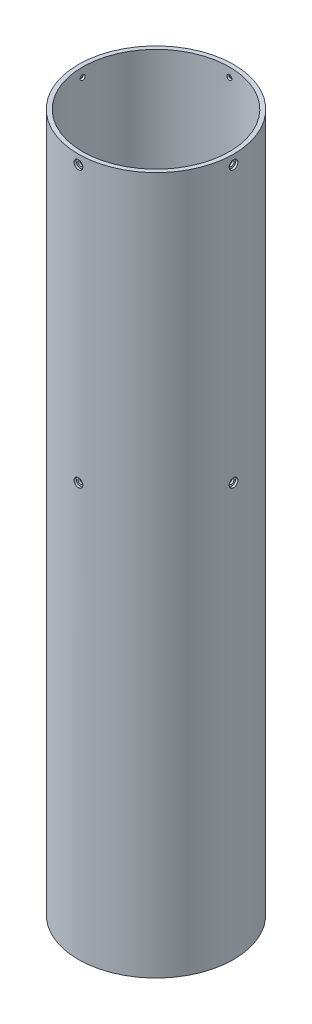
from build123d import *

# Parameters (mm, degrees)
SKETCH1_R                         = 53.721
SKETCH1_R_2                       = 50.8
BODY_EXTRUSION_DEPTH              = 482.6
UPPER_BULKHEAD_HOLES_REACH        = 499.325
SKETCH2_R                         = 1.7526
UPPER_BULKHEAD_HOLE_PATTERN_COUNT = 4
LOWER_BULKHEAD_HOLES_REACH        = 499.325
SKETCH3_R                         = 1.7526
LOWER_BULKHEAD_HOLE_PATTERN_COUNT = 4
SKETCH4_R                         = 3.0226
COUNTERSINK_DEPTH                 = 1.524
COUNTERSINK_PATTERN_COUNT         = 4


with BuildPart() as part:
    # Sketch1 → Body Extrusion (new body)
    with BuildSketch(Plane(origin=(0, 0, 0), x_dir=(1, 0, 0), z_dir=(0, 1, 0))):
        Circle(SKETCH1_R)
        Circle(SKETCH1_R_2, mode=Mode.SUBTRACT)
    extrude(amount=BODY_EXTRUSION_DEPTH)

    # Sketch2 → Upper Bulkhead Holes (cut, up to next)
    with BuildSketch(Plane.XY.offset(53.721), mode=Mode.PRIVATE) as upper_bulkhead_holes_sk1:
        with Locations((0, 476.25)):
            Circle(SKETCH2_R)
    upper_bulkhead_holes_tool1 = extrude(upper_bulkhead_holes_sk1.sketch, amount=-UPPER_BULKHEAD_HOLES_REACH, mode=Mode.PRIVATE) & part.part
    upper_bulkhead_holes = upper_bulkhead_holes_tool1.solids().sort_by_distance((0, 476.25, 53.721))[0]
    add(upper_bulkhead_holes, mode=Mode.SUBTRACT)

    # Upper Bulkhead Hole Pattern: Upper Bulkhead Holes ×4 about axis
    upper_bulkhead_hole_pattern_axis = Axis((0, 482.6, 0), (0, -1, 0))
    for i in range(1, UPPER_BULKHEAD_HOLE_PATTERN_COUNT):
        add(upper_bulkhead_holes.rotate(upper_bulkhead_hole_pattern_axis, i * 360 / UPPER_BULKHEAD_HOLE_PATTERN_COUNT), mode=Mode.SUBTRACT)

    # Sketch3 → Lower Bulkhead Holes (cut, up to next)
    with BuildSketch(Plane.XY.offset(53.721), mode=Mode.PRIVATE) as lower_bulkhead_holes_sk1:
        with Locations((0, 285.75)):
            Circle(SKETCH3_R)
    lower_bulkhead_holes_tool1 = extrude(lower_bulkhead_holes_sk1.sketch, amount=-LOWER_BULKHEAD_HOLES_REACH, mode=Mode.PRIVATE) & part.part
    lower_bulkhead_holes = lower_bulkhead_holes_tool1.solids().sort_by_distance((0, 285.75, 53.721))[0]
    add(lower_bulkhead_holes, mode=Mode.SUBTRACT)

    # Lower Bulkhead Hole Pattern: Lower Bulkhead Holes ×4 about axis
    lower_bulkhead_hole_pattern_axis = Axis((0, 482.6, 0), (0, -1, 0))
    for i in range(1, LOWER_BULKHEAD_HOLE_PATTERN_COUNT):
        add(lower_bulkhead_holes.rotate(lower_bulkhead_hole_pattern_axis, i * 360 / LOWER_BULKHEAD_HOLE_PATTERN_COUNT), mode=Mode.SUBTRACT)

    # Sketch4 → Countersink (cut)
    with BuildSketch(Plane.XY.offset(53.721)):
        with Locations((0, 476.25)):
            Circle(SKETCH4_R)
        with Locations((0, 285.75)):
            Circle(SKETCH4_R)
    countersink = extrude(amount=-COUNTERSINK_DEPTH, mode=Mode.SUBTRACT)

    # Countersink Pattern: Countersink ×4 about axis
    countersink_pattern_axis = Axis((0, 482.6, 0), (0, -1, 0))
    for i in range(1, COUNTERSINK_PATTERN_COUNT):
        add(countersink.rotate(countersink_pattern_axis, i * 360 / COUNTERSINK_PATTERN_COUNT), mode=Mode.SUBTRACT)


solid = part.part
